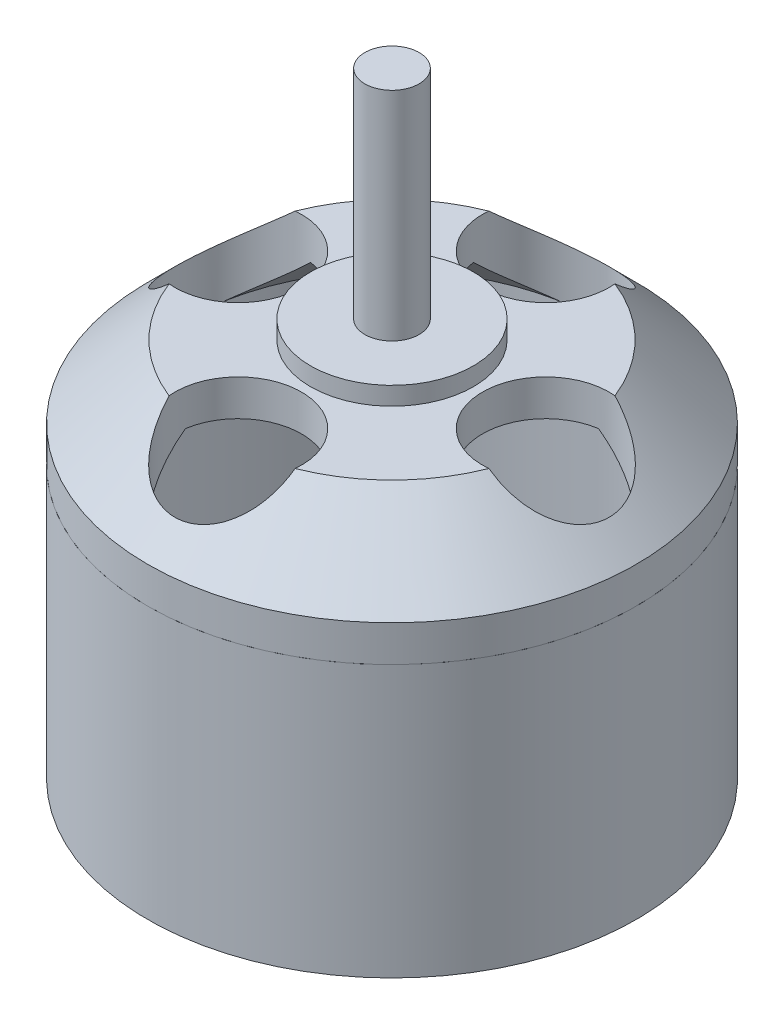
from build123d import *

# Parameters (mm, degrees)
IZIM2_R                          = 13.5
Y_KSEKLIK_EKSTR_ZYON1_DEPTH      = 1
IZIM3_R                          = 13.5
Y_KSEKLIK_EKSTR_ZYON2_DEPTH      = 5
PAH1_SIZE                        = 4
BO_ALTMA1_T                      = -2
IZIM5_R                          = 3.5
KES_EKSTR_ZYON1_DEPTH            = 6
IZIM7_R                          = 4.5
Y_KSEKLIK_EKSTR_ZYON4_DEPTH      = 1
IZIM6_R                          = 13.5
IZIM6_R_2                        = 12.5
Y_KSEKLIK_EKSTR_ZYON6_DEPTH      = 15
Y_KSEKLIK_EKSTR_ZYON7_DEPTH      = 12
Y_KSEKLIK_EKSTR_ZYON7_DEPTH_BACK = 30
IZIM8_R                          = 1.5


with BuildPart() as part:
    # Çizim2 → Yükseklik-Ekstrüzyon1 (new body)
    with BuildSketch(Plane(origin=(0, 0, 0), x_dir=(1, 0, 0), z_dir=(0, 1, 0))):
        Circle(IZIM2_R)
    extrude(amount=Y_KSEKLIK_EKSTR_ZYON1_DEPTH)

    # Çizim3 → Yükseklik-Ekstrüzyon2 (add)
    with BuildSketch(Plane(origin=(0, 1, 0), x_dir=(1, 0, 0), z_dir=(0, 1, 0))):
        Circle(IZIM3_R)
    extrude(amount=Y_KSEKLIK_EKSTR_ZYON2_DEPTH)

    # Pah1
    pah1_edges = [part.edges().sort_by_distance(p)[0] for p in [
        (-13.5, 6, 0),
    ]]
    chamfer(pah1_edges, length=PAH1_SIZE)

    # İç Boşaltma1
    bo_altma1_openings = [part.faces().sort_by_distance(p)[0] for p in [
        (0, 0, 0),
    ]]
    offset(amount=BO_ALTMA1_T, openings=bo_altma1_openings, kind=Kind.INTERSECTION)

    # Çizim5 → Kes-Ekstrüzyon1 (cut)
    with BuildSketch(Plane(origin=(0, 6, 0), x_dir=(1, 0, 0), z_dir=(0, 1, 0))):
        with Locations((0, -8.5)):
            Circle(IZIM5_R)
        with Locations((-8.5, 0)):
            Circle(IZIM5_R)
        with Locations((0, 8.5)):
            Circle(IZIM5_R)
        with Locations((8.5, 0)):
            Circle(IZIM5_R)
    extrude(amount=-KES_EKSTR_ZYON1_DEPTH, mode=Mode.SUBTRACT)

    # Çizim7 → Yükseklik-Ekstrüzyon4 (add)
    with BuildSketch(Plane(origin=(0, 6, 0), x_dir=(1, 0, 0), z_dir=(0, 1, 0))):
        Circle(IZIM7_R)
    extrude(amount=Y_KSEKLIK_EKSTR_ZYON4_DEPTH)


with BuildPart() as body_2:
    # Çizim6 → Yükseklik-Ekstrüzyon6 (new body)
    with BuildSketch(Plane.XZ):
        Circle(IZIM6_R)
        Circle(IZIM6_R_2, mode=Mode.SUBTRACT)
    extrude(amount=Y_KSEKLIK_EKSTR_ZYON6_DEPTH)


with BuildPart() as body_3:
    # Çizim8 → Yükseklik-Ekstrüzyon7 (new, two sides: drawn at the far end of the back side and taken through both)
    with BuildSketch(Plane(origin=(0, 7, 0), x_dir=(1, 0, 0), z_dir=(0, 1, 0)).offset(-Y_KSEKLIK_EKSTR_ZYON7_DEPTH_BACK)):
        Circle(IZIM8_R)
    extrude(amount=Y_KSEKLIK_EKSTR_ZYON7_DEPTH + Y_KSEKLIK_EKSTR_ZYON7_DEPTH_BACK)


solid = Compound([part.part, body_2.part, body_3.part])
